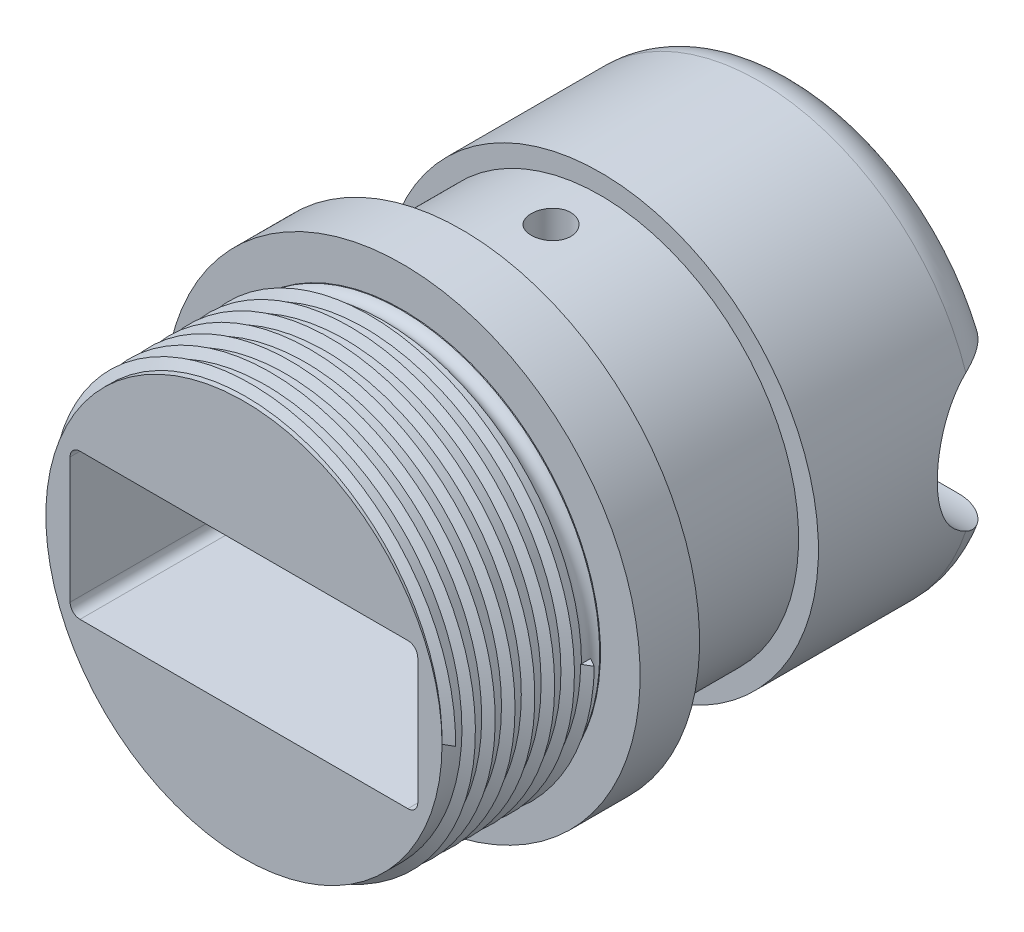
from build123d import *

# Parameters (mm, degrees)
FILLET_1_R               = 2
CUT_EXTRUDE_START        = -1.5
SKETCH_6_R               = 4
CUT_EXTRUDE_2_DEPTH      = 9.5
CUT_EXTRUDE_3_DEPTH      = 8
CUT_EXTRUDE_3_DEPTH_BACK = 8
SKETCH_11_R              = 0.5
SKETCH_13_W              = 17.55
SKETCH_13_H              = 7.35
CUT_EXTRUDE_4_DEPTH      = 18
FILLET_2_R               = 0.5
SKETCH_15_R              = 1
CUT_EXTRUDE_5_DEPTH      = 4.5
SKETCH_16_R              = 0.5
CUT_EXTRUDE_6_DEPTH      = 6
SWEEP_1_PITCH            = 1


with BuildPart() as part:
    # 草图2 → 旋转1 (revolve)
    with BuildSketch(Plane(origin=(0, 0, 0), x_dir=(1, 0, 0), z_dir=(0, 1, 0)), mode=Mode.PRIVATE) as revolve_1_sk:
        Polygon((0, 20), (11, 20), (11, 10), (10, 10), (10, 3), (12, 3), (12, 0), (10, 0), (10, -8), (0, -8), align=None)
    revolve(revolve_1_sk.sketch.rotate(Axis((0, 0, -26.904723116), (0, 0, 1)), 180), axis=Axis((0, 0, -26.904723116), (0, 0, 1)))

    # 圆角1
    fillet_1_edges = [part.edges().sort_by_distance(p)[0] for p in [
        (11, 0, -20),
    ]]
    fillet(fillet_1_edges, radius=FILLET_1_R)

    # 草图6 → 切除-拉伸2 (cut)
    with BuildSketch(Plane(origin=(3, 0, 0), x_dir=(0, 0, -1), z_dir=(1, 0, 0)).offset(CUT_EXTRUDE_START)):
        with Locations((20, 0)):
            Circle(SKETCH_6_R)
    cut_extrude_2 = extrude(amount=CUT_EXTRUDE_2_DEPTH, mode=Mode.SUBTRACT)

    # 镜向1: 切除-拉伸2 across plane
    add(cut_extrude_2.mirror(Plane(origin=(0, 0, 0), x_dir=(0, 0, 1), z_dir=(1, 0, 0))), mode=Mode.SUBTRACT)

    # 草图7 → 切除-拉伸3 (cut, two sides: drawn at the far end of the back side and taken through both)
    with BuildSketch(Plane(origin=(0, 0, 0), x_dir=(0, 0, -1), z_dir=(1, 0, 0)).offset(-CUT_EXTRUDE_3_DEPTH_BACK)):
        with BuildLine():
            Line((18.683146781, 1.817747172), (18.683146781, -1.637277549))
            ThreePointArc((18.683146781, -1.637277549), (18, -2.32042433), (17.316853219, -1.637277549))
            Line((17.316853219, -1.637277549), (17.316853219, 1.817747172))
            ThreePointArc((17.316853219, 1.817747172), (18, 2.500893952), (18.683146781, 1.817747172))
        make_face()
    extrude(amount=CUT_EXTRUDE_3_DEPTH + CUT_EXTRUDE_3_DEPTH_BACK, mode=Mode.SUBTRACT)

    # 草图11 → 切除-旋转1 (revolve, cut)
    with BuildSketch(Plane(origin=(0, 0, 0), x_dir=(0, 0, -1), z_dir=(1, 0, 0)), mode=Mode.PRIVATE) as cut_revolve_1_sk:
        with Locations((-0.5, 10.2)):
            Circle(SKETCH_11_R)
    revolve(cut_revolve_1_sk.sketch.rotate(Axis((0, 0, 8.224695311), (0, 0, -1)), 270), axis=Axis((0, 0, 8.224695311), (0, 0, -1)), mode=Mode.SUBTRACT)

    # 草图13 → 切除-拉伸4 (cut)
    with BuildSketch(Plane.XY.offset(8)):
        Rectangle(SKETCH_13_W, SKETCH_13_H)
    extrude(amount=-CUT_EXTRUDE_4_DEPTH, mode=Mode.SUBTRACT)

    # 圆角2
    fillet_2_edges = [part.edges().sort_by_distance(p)[0] for p in [
        (8.775, 3.675, -1),
        (8.775, -3.675, -1),
        (-8.775, -3.675, -1),
        (-8.775, 3.675, -1),
    ]]
    fillet(fillet_2_edges, radius=FILLET_2_R)

    # 草图15 → 切除-拉伸5 (cut)
    with BuildSketch(Plane(origin=(0, 10, 0), x_dir=(1, 0, 0), z_dir=(0, 1, 0))):
        with Locations(Location((0, 7.5, 0), (0, 0, 270))):
            Circle(SKETCH_15_R)
    cut_extrude_5 = extrude(amount=-CUT_EXTRUDE_5_DEPTH, mode=Mode.SUBTRACT)

    # 草图16 → 切除-拉伸6 (cut)
    with BuildSketch(Plane(origin=(0, 5.5, 0), x_dir=(1, 0, 0), z_dir=(0, 1, 0))):
        with Locations(Location((0, 7.5, 0), (0, 0, 270))):
            Circle(SKETCH_16_R)
    cut_extrude_6 = extrude(amount=-CUT_EXTRUDE_6_DEPTH, mode=Mode.SUBTRACT)

    # 镜向3: 切除-拉伸5, 切除-拉伸6 across plane
    add(cut_extrude_5.mirror(Plane.ZX), mode=Mode.SUBTRACT)
    add(cut_extrude_6.mirror(Plane.ZX), mode=Mode.SUBTRACT)

    # 扫描1: the profile of 草图34 profile screwed along a left-hand helix of 7 turns, 8 arcs to a turn; built about Z, then put on its axis
    sweep_1_z = Axis((0, 0, 0), (0, 0, 1))
    sweep_1_corners = [(9.9997, 0, -0.000173205), (9.9997, 0, 0.500173205), (10.433012702, 0, 0.25)]
    with BuildLine(mode=Mode.PRIVATE) as sweep_1_profile:
        Line(sweep_1_corners[0], sweep_1_corners[1])
        Line(sweep_1_corners[1], sweep_1_corners[2])
        Line(sweep_1_corners[2], sweep_1_corners[0])
    sweep_1_cap = Face(sweep_1_profile.wire())
    sweep_1_turn_angles = [0, -22.5, -45, -67.5, -90, -112.5, -135, -157.5, -180, -202.5, -225, -247.5, -270, -292.5, -315, -337.5, -360]
    sweep_1_turn_weights = [1, 0.9238795325112867, 1, 0.9238795325112867, 1, 0.9238795325112867, 1, 0.9238795325112867, 1, 0.9238795325112867, 1, 0.9238795325112867, 1, 0.9238795325112867, 1, 0.9238795325112867, 1]
    sweep_1_turn_rails = [Edge.make_bspline([Vector(p[0], p[1], 0).rotate(sweep_1_z, sweep_1_turn_angles[k]) / sweep_1_turn_weights[k] + Vector(0, 0, p[2] + -SWEEP_1_PITCH * sweep_1_turn_angles[k] / 360) for k in range(17)], [0, 0, 0, 1, 1, 2, 2, 3, 3, 4, 4, 5, 5, 6, 6, 7, 7, 8, 8, 8], 2, sweep_1_turn_weights) for p in sweep_1_corners]
    sweep_1_turn_sides = [Face.make_surface_from_curves(sweep_1_turn_rails[p[0]], sweep_1_turn_rails[p[1]]) for p in [(0, 1), (1, 2), (2, 0)]]
    sweep_1 = Plane(origin=(0, 0, 8), x_dir=(1, 0, 0), z_dir=(0, 0, -1)) * Solid(Shell([*[p.moved(Location((0, 0, SWEEP_1_PITCH * i))) for i in range(7) for p in sweep_1_turn_sides], sweep_1_cap, sweep_1_cap.rotate(sweep_1_z, -2520).moved(Location((0, 0, -SWEEP_1_PITCH * -2520 / 360)))]))
    add(sweep_1)


solid = part.part
